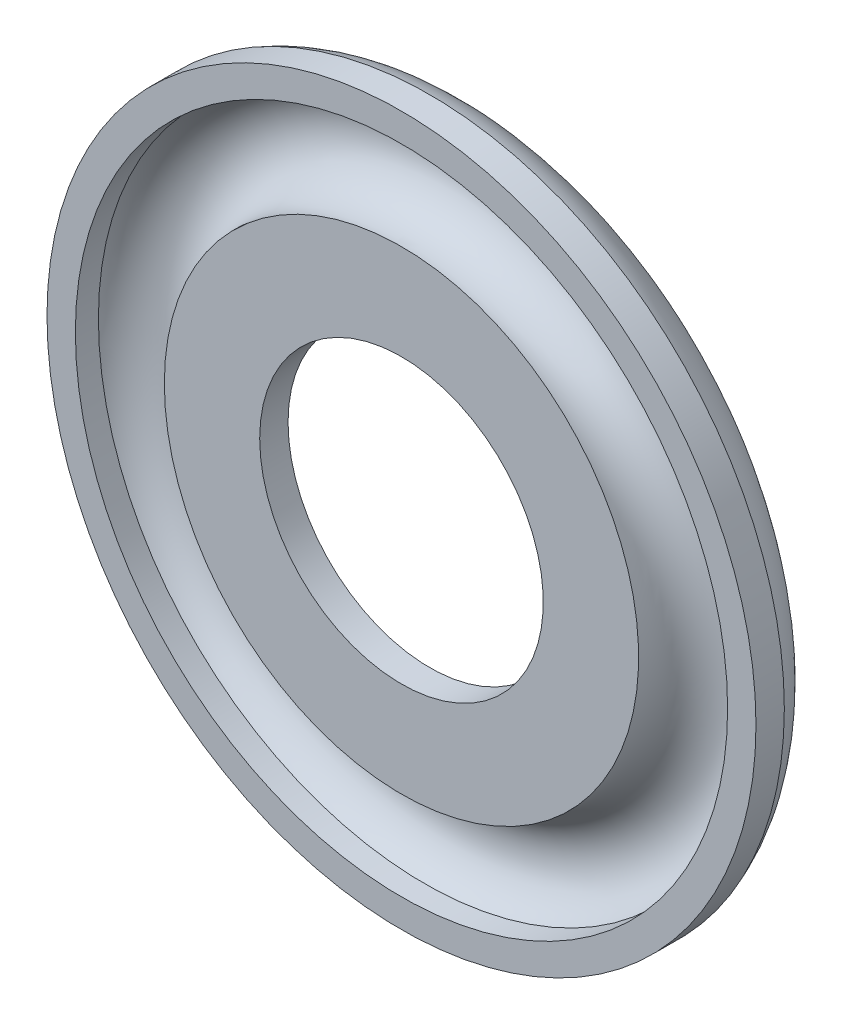
from build123d import *

# Parameters (mm, degrees)
SKETCH_1_R               = 12.5
EXTRUDE_1_DEPTH          = 1
CUT_EXTRUDE_1_DEPTH      = 18.767490446
CUT_EXTRUDE_1_DEPTH_BACK = 18.767490446
SKETCH_4_R               = 5


# Read off the part's stored shape, not the designer's step: 抽壳1
with BuildPart() as part:
    # 草图1 → 凸台-拉伸1 (new body)
    with BuildSketch(Plane.XY):
        Circle(SKETCH_1_R)
    extrude(amount=EXTRUDE_1_DEPTH)

    # 扫描1: sweep along a path in 草图2
    with BuildLine(Plane(origin=(0, 0, 0), x_dir=(-1, 0, 0), z_dir=(0, 0, -1))) as sweep_1_path:
        CenterArc((0, 0), 12.5, 0, 360)
    # 草图3 → 扫描1 (sweep)
    with BuildSketch(Plane(origin=(0, 0, 0), x_dir=(1, 0, 0), z_dir=(0, 1, 0))):
        with BuildLine():
            Line((-12.5, 0), (-7.5, 0))
            ThreePointArc((-7.5, 0), (-10, 1.784295774), (-12.5, 0))
        make_face()
    sweep(path=sweep_1_path.line)

    # 抽壳1 outline → 抽壳1 (revolve, cut)
    with BuildSketch(Plane.XZ):
        with BuildLine():
            Line((11.5, 0.18751359), (11.5, 1))
            Line((11.5, 1), (8.362499328, 1))
            ThreePointArc((8.362499328, 1), (9.587980401, -0.731813124), (11.5, 0.18751359))
        make_face()
    revolve(axis=Axis((0, 0, 0), (0, 0, 1)), mode=Mode.SUBTRACT)

    # 草图4 → 切除-拉伸1 (cut, two sides: drawn at the far end of the back side and taken through both)
    with BuildSketch(Plane(origin=(0, 0, 0), x_dir=(-1, 0, 0), z_dir=(0, 0, -1)).offset(-CUT_EXTRUDE_1_DEPTH_BACK)):
        Circle(SKETCH_4_R)
    extrude(amount=CUT_EXTRUDE_1_DEPTH + CUT_EXTRUDE_1_DEPTH_BACK, mode=Mode.SUBTRACT)


solid = part.part
